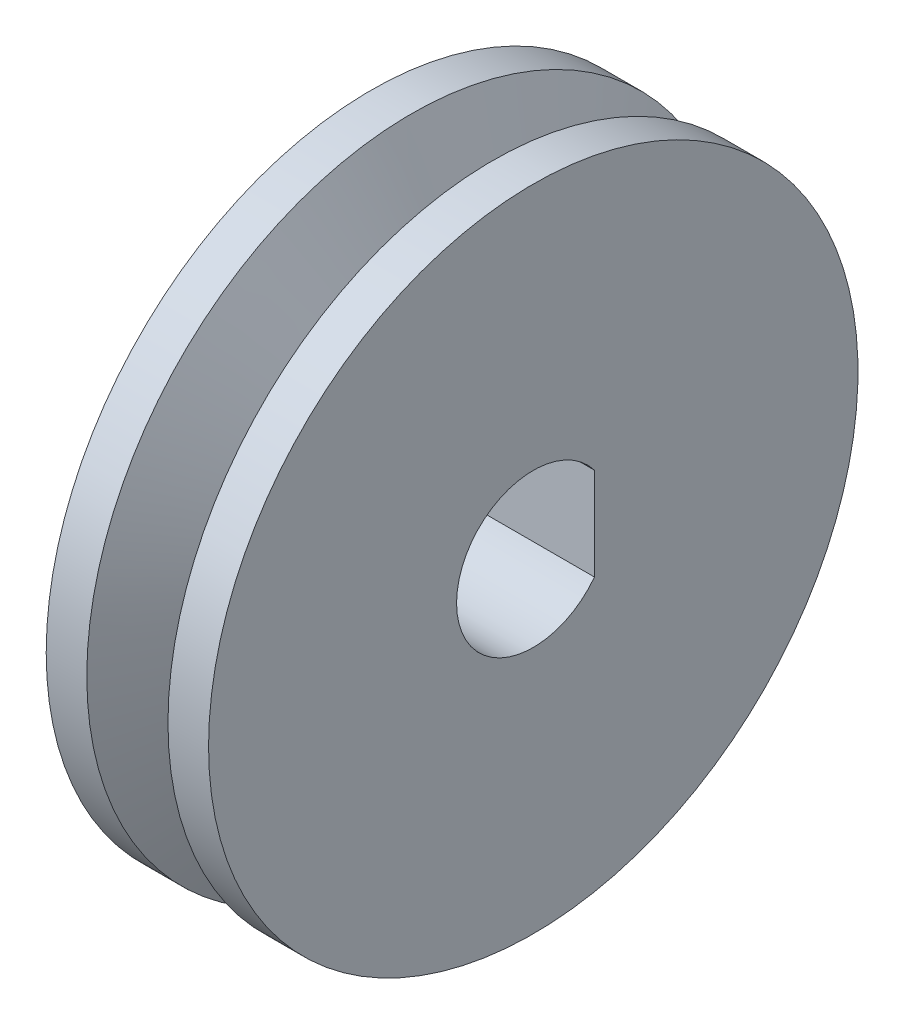
from build123d import *

# Parameters (mm, degrees)
CUT_EXTRUDE1_DEPTH      = 20.05
CUT_EXTRUDE1_DEPTH_BACK = 20.05


with BuildPart() as part:
    # Sketch2 → Revolve1 (revolve)
    with BuildSketch(Plane.XY):
        Polygon((0, 0), (0, 12.7), (1.5875, 12.7), (3.175, 9.525), (4.7625, 12.7), (6.35, 12.7), (6.35, 0), align=None)
    revolve(axis=Axis((0, 0, 0), (1, 0, 0)))

    # Sketch3 → Cut-Extrude1 (cut, two sides: drawn at the far end of the back side and taken through both)
    with BuildSketch(Plane(origin=(6.35, 0, 0), x_dir=(0, 0, -1), z_dir=(1, 0, 0)).offset(-CUT_EXTRUDE1_DEPTH_BACK)):
        with BuildLine():
            Line((2.392934, -1.80937306), (2.392934, 1.80937306))
            ThreePointArc((2.392934, 1.80937306), (-2.999994, 0), (2.392934, -1.80937306))
        make_face()
    extrude(amount=CUT_EXTRUDE1_DEPTH + CUT_EXTRUDE1_DEPTH_BACK, mode=Mode.SUBTRACT)


solid = part.part
